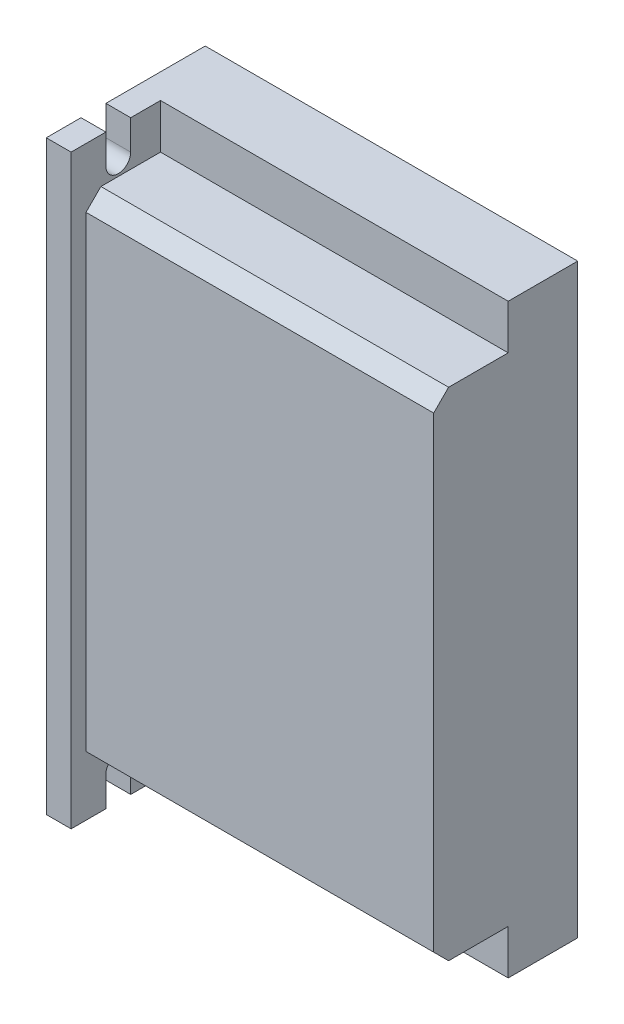
from build123d import *

# Parameters (mm, degrees)
SKETCH_1_W          = 75
SKETCH_1_H          = 100
EXTRUDE_1_DEPTH     = 18
SKETCH_2_W          = 75
SKETCH_2_H          = 118
EXTRUDE_2_DEPTH     = 14
SKETCH_3_W          = 18
SKETCH_3_H          = 118
EXTRUDE_3_DEPTH     = 5
CUT_EXTRUDE_1_DEPTH = 134.529023062
SKETCH_5_W          = 70
SKETCH_5_H          = 100
CUT_EXTRUDE_2_DEPTH = 3
CHAMFER_1_SIZE      = 3


with BuildPart() as part:
    # Эскиз1 → Бобышка-Вытянуть1 (new body)
    with BuildSketch(Plane.XY):
        with Locations((37.5, 50)):
            Rectangle(SKETCH_1_W, SKETCH_1_H)
    extrude(amount=EXTRUDE_1_DEPTH)

    # Эскиз2 → Бобышка-Вытянуть2 (add)
    with BuildSketch(Plane(origin=(0, 0, 0), x_dir=(-1, 0, 0), z_dir=(0, 0, -1))):
        with Locations((-37.5, 50)):
            Rectangle(SKETCH_2_W, SKETCH_2_H)
    extrude(amount=EXTRUDE_2_DEPTH)

    # Эскиз3 → Бобышка-Вытянуть3 (add)
    with BuildSketch(Plane.ZY):
        with Locations((9, 50)):
            Rectangle(SKETCH_3_W, SKETCH_3_H)
    extrude(amount=-EXTRUDE_3_DEPTH)

    # Эскиз4 → Вырез-Вытянуть1 (cut, through all)
    with BuildSketch(Plane.ZY):
        with BuildLine():
            Line((11, 114.734094435), (11, 103))
            ThreePointArc((11, 103), (8.5, 100.5), (6, 103))
            Line((6, 103), (6, 114.734094435))
            ThreePointArc((6, 114.734094435), (8.5, 117.234094435), (11, 114.734094435))
        make_face()
        with BuildLine():
            Line((11, -14.734094435), (11, -3))
            ThreePointArc((11, -3), (8.5, -0.5), (6, -3))
            Line((6, -3), (6, -14.734094435))
            ThreePointArc((6, -14.734094435), (8.5, -17.234094435), (11, -14.734094435))
        make_face()
    extrude(amount=-CUT_EXTRUDE_1_DEPTH, mode=Mode.SUBTRACT)

    # Эскиз5 → Вырез-Вытянуть2 (cut)
    with BuildSketch(Plane.XY.offset(18)):
        with Locations((40, 50)):
            Rectangle(SKETCH_5_W, SKETCH_5_H)
    extrude(amount=-CUT_EXTRUDE_2_DEPTH, mode=Mode.SUBTRACT)

    # Фаска1
    chamfer_1_edges = [part.edges().sort_by_distance(p)[0] for p in [
        (40, 0, 15),
        (40, 100, 15),
    ]]
    chamfer(chamfer_1_edges, length=CHAMFER_1_SIZE)


solid = part.part
